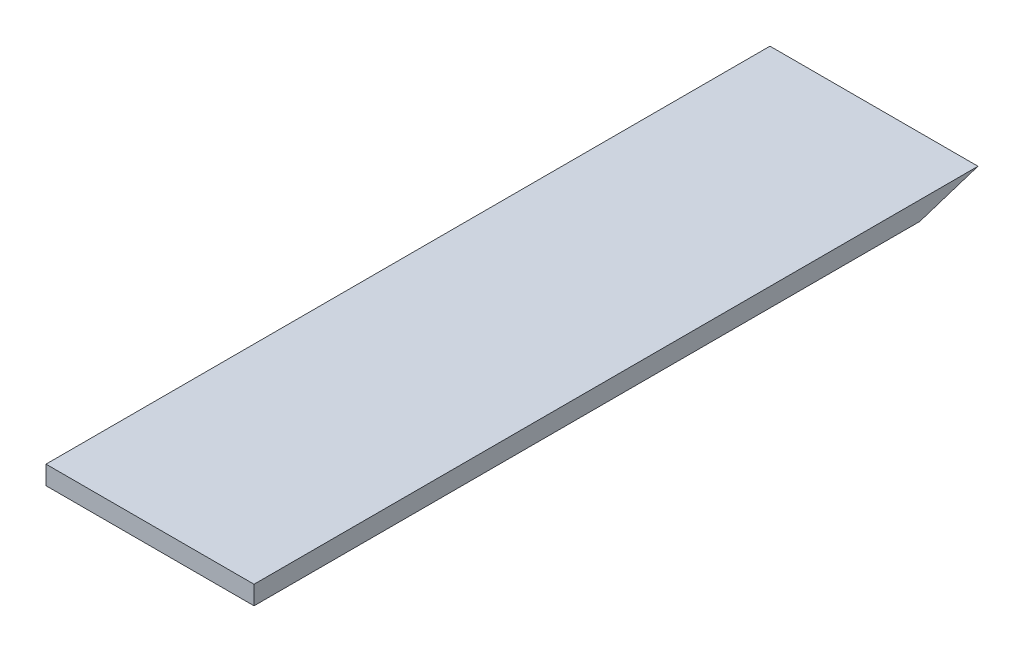
from build123d import *

# Parameters (mm, degrees)
BOSS_EXTRUDE1_DEPTH = 100


with BuildPart() as part:
    # Sketch1 → Boss-Extrude1 (new body)
    with BuildSketch(Plane(origin=(0, 0, 0), x_dir=(0, 0, -1), z_dir=(1, 0, 0))):
        Polygon((0, 9), (0, 0), (320, 0), (348, 9), align=None)
    extrude(amount=BOSS_EXTRUDE1_DEPTH)


solid = part.part
